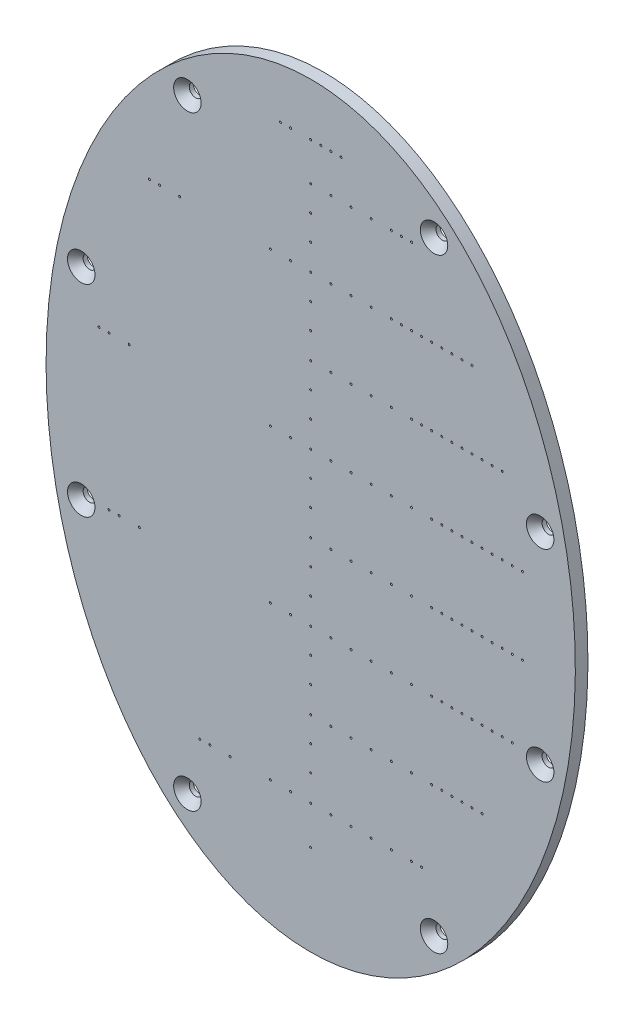
from build123d import *

# Parameters (mm, degrees)
SKETCH2_RX                                    = 95.25
SKETCH2_RY                                    = 66.675
BOSS_EXTRUDE1_DEPTH                           = 3.175
CSK_FOR_4_FLAT_HEAD_SOCKET_CAP_SCREW1_A_COUNT = 2
CSK_FOR_4_FLAT_HEAD_SOCKET_CAP_SCREW1_A_PITCH = 57.407075067
CSK_FOR_4_FLAT_HEAD_SOCKET_CAP_SCRE_2_COUNT   = 2
CSK_FOR_4_FLAT_HEAD_SOCKET_CAP_SCRE_2_PITCH   = 152.4
CSK_FOR_4_FLAT_HEAD_SOCKET_CAP_SCRE_3_COUNT   = 2
CSK_FOR_4_FLAT_HEAD_SOCKET_CAP_SCRE_3_PITCH   = 105.059470148
CBORE_FOR_1_2_HEX_HEAD_BOLT1_D                = 0.508
CBORE_FOR_1_2_HEX_HEAD_BOLT1_DEPTH            = 6.35
CBORE_FOR_1_2_HEX_HEAD_BOLT1_CBORE_D          = 1.016
CBORE_FOR_1_2_HEX_HEAD_BOLT1_CBORE_DEPTH      = 1.5875
CBORE_FOR_1_2_HEX_HEAD_BOLT1_TIP              = 0.152618597


with BuildPart() as part:
    # Sketch2 → Boss-Extrude1 (new body)
    with BuildSketch(Plane.XY):
        with Locations(Location((0, 0), (0, 0, 90))):
            Ellipse(SKETCH2_RX, SKETCH2_RY)
    extrude(amount=BOSS_EXTRUDE1_DEPTH)

    # Sketch3 → CSK for #4 Flat Head Socket Cap Screw1 (revolve, cut)
    with BuildSketch(Plane(origin=(31.072125813, 76.2, 3.175), x_dir=(0, -1, 0), z_dir=(1, 0, 0))):
        Polygon((0, 0), (0, 92.928574487), (1.63195, 91.948), (1.63195, 2.10212824), (3.4593022, 0), align=None)
    csk_for_4_flat_head_socket_cap_screw1 = revolve(axis=Axis((31.072125813, 76.2, 9.525), (0, 0, -1)), mode=Mode.SUBTRACT)

    # CSK for #4 Flat Head Socket Cap Screw1 a: CSK for #4 Flat Head Socket Cap Screw1 ×2
    with Locations(*[Vector(0.46576519237714864, -0.8849083486835673, 0) * (i * CSK_FOR_4_FLAT_HEAD_SOCKET_CAP_SCREW1_A_PITCH) for i in range(1, CSK_FOR_4_FLAT_HEAD_SOCKET_CAP_SCREW1_A_COUNT)]):
        add(csk_for_4_flat_head_socket_cap_screw1, mode=Mode.SUBTRACT)

    # CSK for _4 Flat Head Socket Cap Scre 2: CSK for #4 Flat Head Socket Cap Screw1 ×2
    with Locations(*[(0, -i * CSK_FOR_4_FLAT_HEAD_SOCKET_CAP_SCRE_2_PITCH, 0) for i in range(1, CSK_FOR_4_FLAT_HEAD_SOCKET_CAP_SCRE_2_COUNT)]):
        add(csk_for_4_flat_head_socket_cap_screw1, mode=Mode.SUBTRACT)

    # CSK for _4 Flat Head Socket Cap Scre 3: CSK for #4 Flat Head Socket Cap Screw1 ×2
    with Locations(*[Vector(0.25450554171511, -0.9670713154862461, 0) * (i * CSK_FOR_4_FLAT_HEAD_SOCKET_CAP_SCRE_3_PITCH) for i in range(1, CSK_FOR_4_FLAT_HEAD_SOCKET_CAP_SCRE_3_COUNT)]):
        add(csk_for_4_flat_head_socket_cap_screw1, mode=Mode.SUBTRACT)

    # Mirror1: CSK for #4 Flat Head Socket Cap Screw1 across plane
    add(csk_for_4_flat_head_socket_cap_screw1.mirror(Plane(origin=(0, 0, 0), x_dir=(0, 0, 1), z_dir=(1, 0, 0))), mode=Mode.SUBTRACT)

    # Mirror1 copy 1 sketch → Mirror1 copy 1 (revolve, cut)
    with BuildSketch(Plane(origin=(-57.810343175, 25.4, 3.175), x_dir=(0, -1, 0), z_dir=(-1, 0, 0))):
        Polygon((0, 0), (0, -92.928574487), (1.63195, -91.948), (1.63195, -2.10212824), (3.4593022, 0), align=None)
    revolve(axis=Axis((-57.810343175, 25.4, 9.525), (0, 0, 1)), mode=Mode.SUBTRACT)

    # Mirror1 copy 2 sketch → Mirror1 copy 2 (revolve, cut)
    with BuildSketch(Plane(origin=(-31.072125813, -76.2, 3.175), x_dir=(0, -1, 0), z_dir=(-1, 0, 0))):
        Polygon((0, 0), (0, -92.928574487), (1.63195, -91.948), (1.63195, -2.10212824), (3.4593022, 0), align=None)
    revolve(axis=Axis((-31.072125813, -76.2, 9.525), (0, 0, 1)), mode=Mode.SUBTRACT)

    # Mirror1 copy 3 sketch → Mirror1 copy 3 (revolve, cut)
    with BuildSketch(Plane(origin=(-57.810343175, -25.4, 3.175), x_dir=(0, -1, 0), z_dir=(-1, 0, 0))):
        Polygon((0, 0), (0, -92.928574487), (1.63195, -91.948), (1.63195, -2.10212824), (3.4593022, 0), align=None)
    revolve(axis=Axis((-57.810343175, -25.4, 9.525), (0, 0, 1)), mode=Mode.SUBTRACT)

    # CBORE for 1/2 Hex Head Bolt1
    with Locations(Plane(origin=(0, 0, 0), x_dir=(-1, 0, 0), z_dir=(0, 0, -1))):
        with Locations((0, 72.39), (0, 53.086), (0, 33.782), (0, 14.478), (0, -4.826), (0, -24.13), (0, -43.434), (0, -62.738), (0, -72.39), (0, 82.042), (-5.08, 82.042), (-7.62, 82.042), (-2.54, 82.042), (-20.32, 72.39), (-15.24, 72.39), (-10.16, 72.39), (-5.08, 72.39), (-22.86, 72.39), (-5.08, 53.086), (-10.16, 53.086), (-15.24, 53.086), (-20.32, 53.086), (-22.86, 53.086), (-25.4, 53.086), (-27.94, 53.086), (-30.48, 53.086), (-33.02, 53.086), (-35.56, 53.086), (-38.1, 53.086), (-10.16, 33.782), (-15.24, 33.782), (-20.32, 33.782), (-25.4, 33.782), (-27.94, 33.782), (-30.48, 33.782), (-33.02, 33.782), (-35.56, 33.782), (-38.1, 33.782), (-40.64, 33.782), (-43.18, 33.782), (-45.72, 33.782), (-48.26, 33.782), (-5.08, 33.782), (-5.08, 14.478), (-10.16, 14.478), (-15.24, 14.478), (-20.32, 14.478), (-25.4, 14.478), (-30.48, 14.478), (-33.02, 14.478), (-35.56, 14.478), (-38.1, 14.478), (-40.64, 14.478), (-43.18, 14.478), (-45.72, 14.478), (-48.26, 14.478), (-50.8, 14.478), (-53.34, 14.478), (-5.08, -4.826), (-10.16, -4.826), (-15.24, -4.826), (-20.32, -4.826), (-25.4, -4.826), (-30.48, -4.826), (-33.02, -4.826), (-35.56, -4.826), (-38.1, -4.826), (-40.64, -4.826), (-43.18, -4.826), (-45.72, -4.826), (-48.26, -4.826), (-50.8, -4.826), (-53.34, -4.826), (-5.08, -24.13), (-10.16, -24.13), (-15.24, -24.13), (-20.32, -24.13), (-25.4, -24.13), (-30.48, -24.13), (-33.02, -24.13), (-35.56, -24.13), (-38.1, -24.13), (-40.64, -24.13), (-43.18, -24.13), (-45.72, -24.13), (-48.26, -24.13), (-50.8, -24.13), (-5.08, -43.434), (-10.16, -43.434), (-15.24, -43.434), (-20.32, -43.434), (-25.4, -43.434), (-30.48, -43.434), (-35.56, -43.434), (-38.1, -43.434), (-40.64, -43.434), (-43.18, -43.434), (-27.94, -62.738), (-25.4, -62.738), (-20.32, -62.738), (-15.24, -62.738), (-10.16, -62.738), (-5.08, -62.738), (-33.02, -43.434), (-40.64, 53.086), (-25.4, 72.39), (7.62, 82.042), (5.08, 82.042), (40.64, 53.086), (33.02, 53.086), (38.1, 53.086), (5.08, 53.086), (10.16, 53.086), (5.08, 14.478), (10.16, 14.478), (53.34, 14.478), (50.8, 14.478), (45.72, 14.478), (5.08, -24.13), (10.16, -24.13), (50.8, -24.13), (48.26, -24.13), (43.18, -24.13), (10.16, -62.738), (5.08, -62.738), (27.94, -62.738), (25.4, -62.738), (20.32, -62.738), (0, 66.04), (0, 59.69), (0, 46.736), (0, 40.386), (0, 27.432), (0, 21.082), (0, 8.128), (0, 1.778), (0, -11.176), (0, -17.526), (0, -30.48), (0, -36.83), (0, -49.784), (0, -56.134)):
            CounterBoreHole(CBORE_FOR_1_2_HEX_HEAD_BOLT1_D / 2, CBORE_FOR_1_2_HEX_HEAD_BOLT1_CBORE_D / 2, CBORE_FOR_1_2_HEX_HEAD_BOLT1_CBORE_DEPTH, depth=CBORE_FOR_1_2_HEX_HEAD_BOLT1_DEPTH)
            with Locations((0, 0, -(CBORE_FOR_1_2_HEX_HEAD_BOLT1_DEPTH + CBORE_FOR_1_2_HEX_HEAD_BOLT1_TIP / 2))):  # 118° drill point
                Cone(0, CBORE_FOR_1_2_HEX_HEAD_BOLT1_D / 2, CBORE_FOR_1_2_HEX_HEAD_BOLT1_TIP, mode=Mode.SUBTRACT)


solid = part.part
